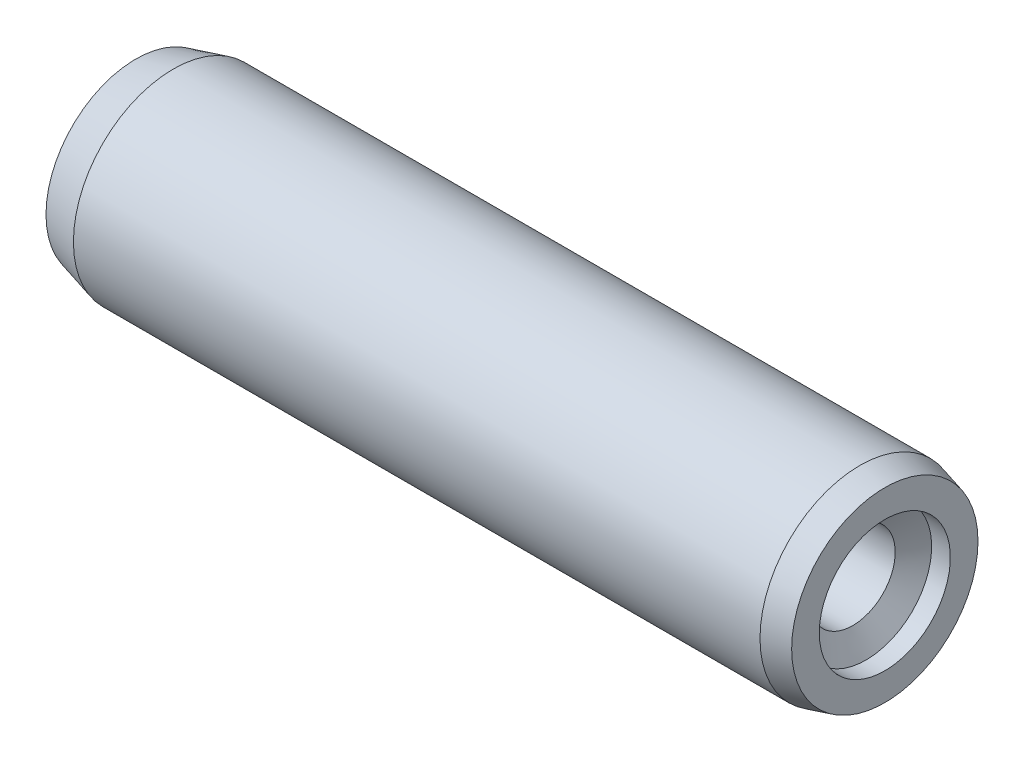
from build123d import *


with BuildPart() as part:
    # BodySke → Body (revolve)
    with BuildSketch(Plane.XY):
        Polygon((3, 8), (58, 8), (60, 7.464101615), (60, 5.25), (58.5, 5.25), (57.431902002, 3.4), (35, 3.4), (33.591673888, 0), (0, 0), (0, 7.196152423), align=None)
    revolve(axis=Axis((0, 0, 0), (1, 0, 0)))


solid = part.part
